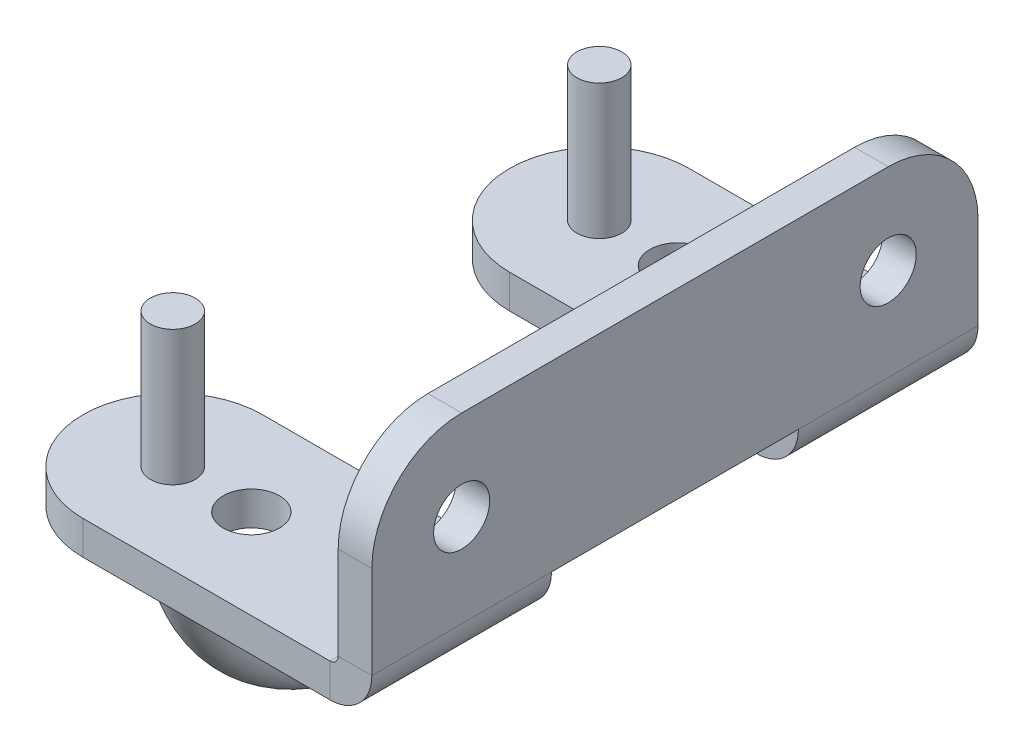
from build123d import *

# Parameters (mm, degrees)
SKETCH1_R           = 2.5
SKETCH1_R_2         = 2
BASE_FLANGE1_DEPTH  = 3
EDGE_FLANGE1_DEPTH  = 16
SKETCH10_R          = 2.5
CUT_EXTRUDE1_DEPTH  = 10
TAB1_START          = -3
TAB1_DEPTH          = 3
SWEEP1_PROFILE_R    = 2
BOSS_EXTRUDE1_START = 15
SKETCH35_R          = 2
BOSS_EXTRUDE1_DEPTH = 15


# Read off the part's stored shape, not the designer's step: Tab1
# Sheet-metal steps are written as plain solids
with BuildPart() as part:
    # Sketch1 → Base-Flange1 (new body)
    with BuildSketch(Plane(origin=(0, 0, 0), x_dir=(1, 0, 0), z_dir=(0, 1, 0))):
        with BuildLine():
            Line((0, -8), (-7, -8))
            ThreePointArc((-7, -8), (-15, 0), (-7, 8))
            Line((-7, 8), (0, 8))
            Line((0, 8), (15, 8))
            Line((15, 8), (15, -8))
            Line((15, -8), (0, -8))
        make_face()
        with Locations(Location((0, 0, 0), (0, 0, 270))):
            Circle(SKETCH1_R, mode=Mode.SUBTRACT)
        with Locations(Location((-7, 0, 0), (0, 0, 270))):
            Circle(SKETCH1_R_2, mode=Mode.SUBTRACT)
    extrude(amount=-BASE_FLANGE1_DEPTH)

    # Edge-Flange1 section (across the edge) → Edge-Flange1 (add)
    with BuildSketch(Plane(origin=(15.7366, 0, 8), x_dir=(-1, 0, 0), z_dir=(0, 0, -1))):
        with BuildLine():
            Line((-3, 0.7366), (-3, 17))
            Line((-3, 17), (0, 17))
            Line((0, 17), (0, 0.7366))
            ThreePointArc((0, 0.7366), (0.215745145, 0.215745145), (0.7366, 0))
            Line((0.7366, 0), (0.7366, -3))
            ThreePointArc((0.7366, -3), (-1.905575199, -1.905575199), (-3, 0.7366))
        make_face()
    extrude(amount=EDGE_FLANGE1_DEPTH)

    # Sketch10 → Cut-Extrude1 (cut)
    with BuildSketch(Plane.ZY.offset(-15.7366)):
        with BuildLine():
            Line((-8, 17), (-8, 9))
            ThreePointArc((-8, 9), (-5.656854249, 14.656854249), (0, 17))
            Line((0, 17), (-8, 17))
        make_face()
        with BuildLine():
            Line((8, 17), (0, 17))
            ThreePointArc((0, 17), (5.656854249, 14.656854249), (8, 9))
            Line((8, 9), (8, 17))
        make_face()
        with Locations(Location((0, 9, 0), (0, 0, 270))):
            Circle(SKETCH10_R)
    extrude(amount=-CUT_EXTRUDE1_DEPTH, mode=Mode.SUBTRACT)


with BuildPart() as body_2:
    # Mirror1: mirrored copy
    add(part.part.mirror(Plane.XY.offset(-19)))


with BuildPart() as part_1:
    add(part.part)

    add(body_2.part)  # Tab1 merges body 2
    # Tab1 outline → Tab1 (add)
    with BuildSketch(Plane.ZY.offset(-15.7366).offset(TAB1_START)):
        with BuildLine():
            ThreePointArc((-8, 9), (-5.656854249, 14.656854249), (0, 17))
            Line((0, 17), (-38, 17))
            ThreePointArc((-38, 17), (-32.343145751, 14.656854249), (-30, 9))
            Line((-30, 9), (-30, 0.7366))
            Line((-30, 0.7366), (-8, 0.7366))
            Line((-8, 0.7366), (-8, 9))
        make_face()
    extrude(amount=TAB1_DEPTH)



with BuildPart() as body_2_2:
    # Sweep1: sweep along a path in Sketch15
    with BuildLine(Plane.ZY.offset(7)) as sweep1_path:
        ThreePointArc((0, -3), (-19, -22), (-38, -3))
    # Sweep1 profile (on start of the path) → Sweep1 (sweep)
    with BuildSketch(Plane(origin=(-7, -3, 0), x_dir=(-1, 0, 0), z_dir=(0, -1, 0))):
        Circle(SWEEP1_PROFILE_R)
    sweep(path=sweep1_path.line)


with BuildPart() as part_2:
    add(part_1.part)

    add(body_2_2.part)  # Boss-Extrude1 merges body 2 2
    # Sketch35 → Boss-Extrude1 (add)
    with BuildSketch(Plane(origin=(0, -3, 0), x_dir=(1, 0, 0), z_dir=(0, 1, 0)).offset(BOSS_EXTRUDE1_START)):
        with Locations(Location((-7, 38, 0), (0, 0, 90))):
            Circle(SKETCH35_R)
        with Locations(Location((-7, 0, 0), (0, 0, 270))):
            Circle(SKETCH35_R)
    extrude(amount=-BOSS_EXTRUDE1_DEPTH)


solid = part_2.part
